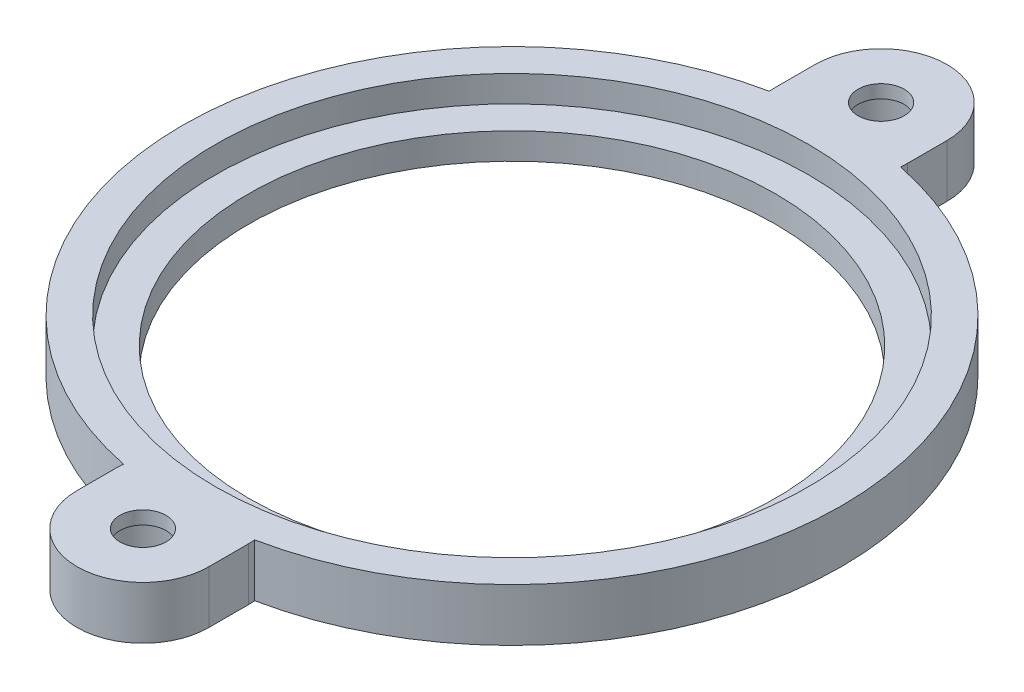
from build123d import *

# Parameters (mm, degrees)
BOSS_EXTRUDE1_DEPTH = 4
SKETCH2_R           = 20
CUT_EXTRUDE1_DEPTH  = 42.593268686
SKETCH3_R           = 22.5
CUT_EXTRUDE2_DEPTH  = 2
SKETCH4_R           = 1.75
CUT_EXTRUDE3_DEPTH  = 42.593268686
SKETCH5_R           = 3.25
CUT_EXTRUDE4_DEPTH  = 3


with BuildPart() as part:
    # Sketch1 → Boss-Extrude1 (new body)
    with BuildSketch(Plane(origin=(0, 0, 0), x_dir=(1, 0, 0), z_dir=(0, 1, 0))):
        with BuildLine():
            Line((-5, 25), (-5, 28))
            ThreePointArc((-5, 28), (0, 33), (5, 28))
            Line((5, 28), (5, 25))
            ThreePointArc((5, 25), (4.993730366, 24.749686125), (4.974937186, 24.5))
            ThreePointArc((4.974937186, 24.5), (25, 0), (4.974937186, -24.5))
            ThreePointArc((4.974937186, -24.5), (4.993730366, -24.749686125), (5, -25))
            Line((5, -25), (5, -28))
            ThreePointArc((5, -28), (0, -33), (-5, -28))
            Line((-5, -28), (-5, -25))
            ThreePointArc((-5, -25), (-4.993730366, -24.749686125), (-4.974937186, -24.5))
            ThreePointArc((-4.974937186, -24.5), (-25, 0), (-4.974937186, 24.5))
            ThreePointArc((-4.974937186, 24.5), (-4.993730366, 24.749686125), (-5, 25))
        make_face()
    extrude(amount=BOSS_EXTRUDE1_DEPTH)

    # Sketch2 → Cut-Extrude1 (cut, through all)
    with BuildSketch(Plane(origin=(0, 4, 0), x_dir=(1, 0, 0), z_dir=(0, 1, 0))):
        Circle(SKETCH2_R)
    extrude(amount=-CUT_EXTRUDE1_DEPTH, mode=Mode.SUBTRACT)

    # Sketch3 → Cut-Extrude2 (cut)
    with BuildSketch(Plane(origin=(0, 4, 0), x_dir=(1, 0, 0), z_dir=(0, 1, 0))):
        Circle(SKETCH3_R)
    extrude(amount=-CUT_EXTRUDE2_DEPTH, mode=Mode.SUBTRACT)

    # Sketch4 → Cut-Extrude3 (cut, through all)
    with BuildSketch(Plane(origin=(0, 4, 0), x_dir=(1, 0, 0), z_dir=(0, 1, 0))):
        with Locations((0, -28)):
            Circle(SKETCH4_R)
        with Locations((0, 28)):
            Circle(SKETCH4_R)
    extrude(amount=-CUT_EXTRUDE3_DEPTH, mode=Mode.SUBTRACT)

    # Sketch5 → Cut-Extrude4 (cut)
    with BuildSketch(Plane.XZ):
        with Locations((0, 28)):
            Circle(SKETCH5_R)
        with Locations((0, -28)):
            Circle(SKETCH5_R)
    extrude(amount=-CUT_EXTRUDE4_DEPTH, mode=Mode.SUBTRACT)


solid = part.part
